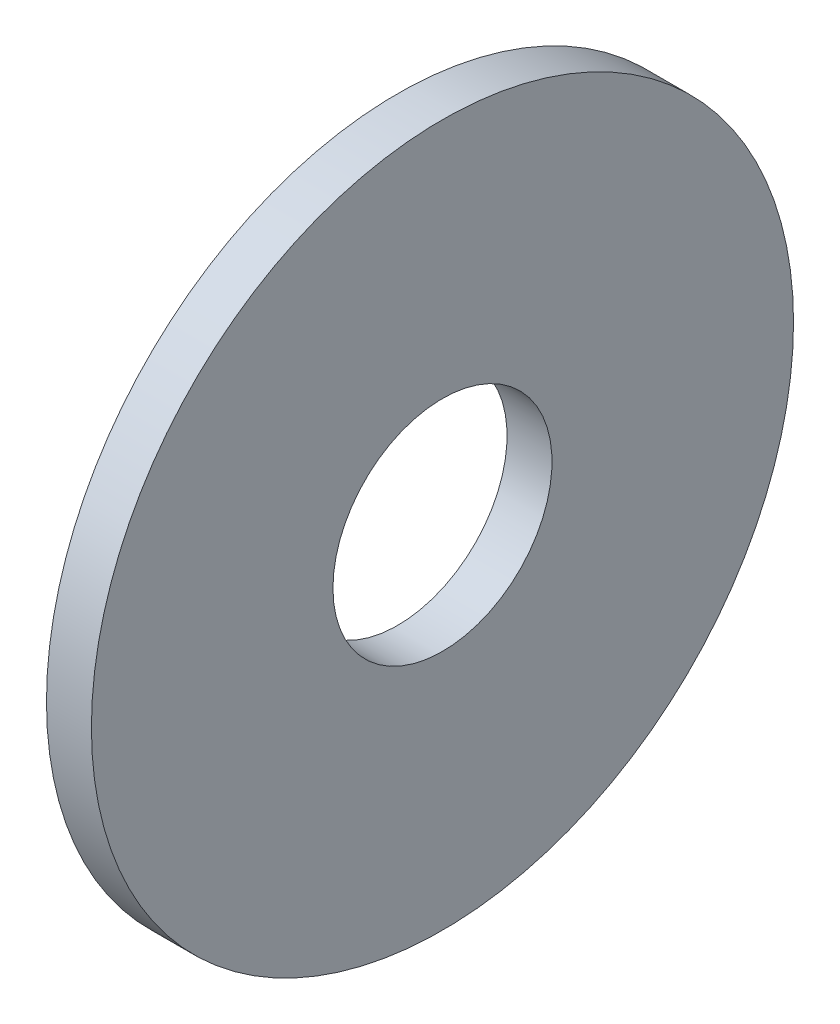
from build123d import *

# Parameters (mm, degrees)
SKETCH1_W = 8
SKETCH1_H = 43


with BuildPart() as part:
    # Sketch1 → Base-Revolve (revolve)
    with BuildSketch(Plane.XY):
        with Locations((-4, 41)):
            Rectangle(SKETCH1_W, SKETCH1_H)
    revolve(axis=Axis((-34.925, 0, 0), (1, 0, 0)))


solid = part.part
